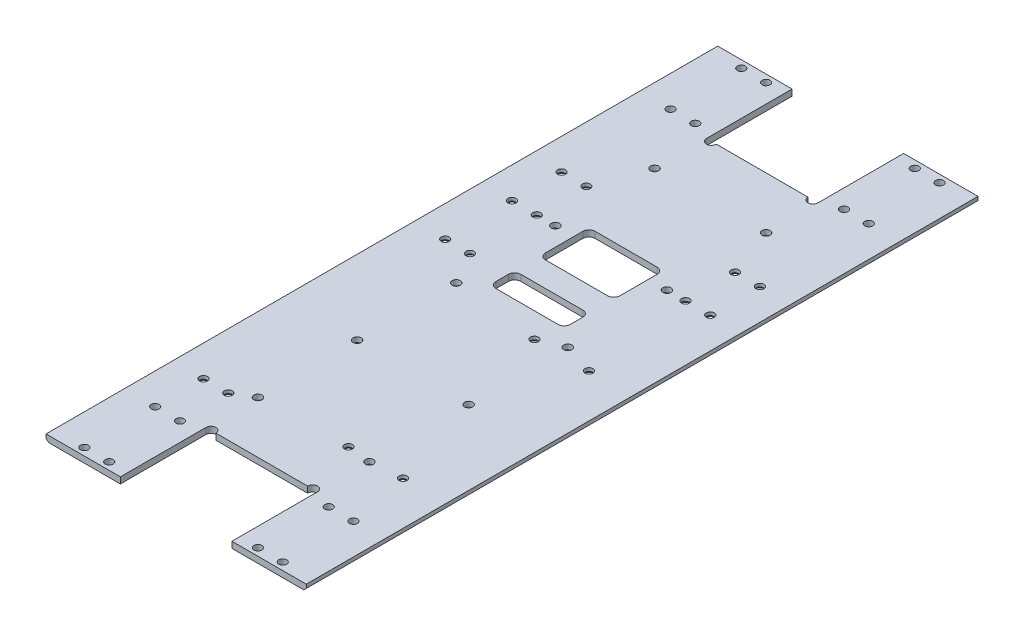
from build123d import *

# Parameters (mm, degrees)
SKETCH_1_W          = 105
SKETCH_1_H          = 271
EXTRUDE_1_DEPTH     = 2.5
SKETCH_2_R          = 1.6
CUT_EXTRUDE_1_DEPTH = 10
CHAMFER_4_SIZE      = 1
SKETCH_3_W          = 45
SKETCH_3_H          = 34.55
CUT_EXTRUDE_2_DEPTH = 10
SKETCH_4_R          = 2
CUT_EXTRUDE_3_DEPTH = 10
SKETCH_5_R          = 1.6
CUT_EXTRUDE_4_DEPTH = 10
SKETCH_6_R          = 1.6
CUT_EXTRUDE_5_DEPTH = 10
SKETCH_7_R          = 1.65
CUT_EXTRUDE_6_DEPTH = 2
CUT_EXTRUDE_7_REACH = 147.337
SKETCH_8_R          = 1.55
CHAMFER_6_SIZE      = 1.2
SKETCH_9_W          = 30
SKETCH_9_H          = 20
SKETCH_9_H_2        = 10
CUT_EXTRUDE_8_DEPTH = 12
FILLET_1_R          = 2.5


with BuildPart() as part:
    # 草图1 → 凸台-拉伸1 (new body)
    with BuildSketch(Plane(origin=(0, 0, 0), x_dir=(1, 0, 0), z_dir=(0, 1, 0))):
        Rectangle(SKETCH_1_W, SKETCH_1_H)
    extrude(amount=EXTRUDE_1_DEPTH)

    # 草图2 → 切除-拉伸1 (cut)
    with BuildSketch(Plane(origin=(0, 2.5, 0), x_dir=(1, 0, 0), z_dir=(0, 1, 0))):
        with Locations((13.000000181, -3.95)):
            Circle(SKETCH_2_R)
        with Locations((35, -3.95)):
            Circle(SKETCH_2_R)
        with Locations((35, -78.95)):
            Circle(SKETCH_2_R)
        with Locations((13.000000181, -78.95)):
            Circle(SKETCH_2_R)
    extrude(amount=-CUT_EXTRUDE_1_DEPTH, mode=Mode.SUBTRACT)

    # 倒角4
    chamfer_4_edges = [part.edges().sort_by_distance(p)[0] for p in [
        (52.5, 0, 0),
        (-52.5, 0, 0),
    ]]
    chamfer(chamfer_4_edges, length=CHAMFER_4_SIZE)

    # 草图3 → 切除-拉伸2 (cut)
    with BuildSketch(Plane.XZ):
        with Locations((0, 118.225)):
            Rectangle(SKETCH_3_W, SKETCH_3_H)
        with Locations((0, -118.225)):
            Rectangle(SKETCH_3_W, SKETCH_3_H)
    extrude(amount=-CUT_EXTRUDE_2_DEPTH, mode=Mode.SUBTRACT)

    # 草图4 → 切除-拉伸3 (cut)
    with BuildSketch(Plane.XZ):
        with Locations((20.5, -100.95)):
            Circle(SKETCH_4_R)
        with Locations((-20.5, -100.95)):
            Circle(SKETCH_4_R)
        with Locations((-20.5, 100.95)):
            Circle(SKETCH_4_R)
        with Locations((20.5, 100.95)):
            Circle(SKETCH_4_R)
    extrude(amount=-CUT_EXTRUDE_3_DEPTH, mode=Mode.SUBTRACT)

    # 草图5 → 切除-拉伸4 (cut)
    with BuildSketch(Plane(origin=(0, 2.5, 0), x_dir=(1, 0, 0), z_dir=(0, 1, 0))):
        with Locations((-40, 103.95)):
            Circle(SKETCH_5_R)
        with Locations((-30, 103.95)):
            Circle(SKETCH_5_R)
        with Locations((-40, 132.5)):
            Circle(SKETCH_5_R)
        with Locations((-30, 132.5)):
            Circle(SKETCH_5_R)
        with Locations((30, 132.5)):
            Circle(SKETCH_5_R)
        with Locations((40, 132.5)):
            Circle(SKETCH_5_R)
        with Locations((30, 103.95)):
            Circle(SKETCH_5_R)
        with Locations((40, 103.95)):
            Circle(SKETCH_5_R)
        with Locations((40, -103.95)):
            Circle(SKETCH_5_R)
        with Locations((30, -103.95)):
            Circle(SKETCH_5_R)
        with Locations((40, -132.5)):
            Circle(SKETCH_5_R)
        with Locations((30, -132.5)):
            Circle(SKETCH_5_R)
        with Locations((-30, -132.5)):
            Circle(SKETCH_5_R)
        with Locations((-40, -132.5)):
            Circle(SKETCH_5_R)
        with Locations((-30, -103.95)):
            Circle(SKETCH_5_R)
        with Locations((-40, -103.95)):
            Circle(SKETCH_5_R)
    extrude(amount=-CUT_EXTRUDE_4_DEPTH, mode=Mode.SUBTRACT)

    # 草图6 → 切除-拉伸5 (cut)
    with BuildSketch(Plane(origin=(0, 2.5, 0), x_dir=(1, 0, 0), z_dir=(0, 1, 0))):
        with Locations((40, 60)):
            Circle(SKETCH_6_R)
        with Locations((30, 60)):
            Circle(SKETCH_6_R)
        with Locations((40, 40)):
            Circle(SKETCH_6_R)
        with Locations((30, 40)):
            Circle(SKETCH_6_R)
        with Locations((-30, 40)):
            Circle(SKETCH_6_R)
        with Locations((-40, 40)):
            Circle(SKETCH_6_R)
        with Locations((-30, 60)):
            Circle(SKETCH_6_R)
        with Locations((-40, 60)):
            Circle(SKETCH_6_R)
        with Locations((-30, -84.45)):
            Circle(SKETCH_6_R)
        with Locations((-40, -84.45)):
            Circle(SKETCH_6_R)
        with Locations((-30, 13.05)):
            Circle(SKETCH_6_R)
        with Locations((-40, 13.05)):
            Circle(SKETCH_6_R)
    extrude(amount=-CUT_EXTRUDE_5_DEPTH, mode=Mode.SUBTRACT)

    # 草图7 → 切除-拉伸6 (cut)
    with BuildSketch(Plane(origin=(0, 2.5, 0), x_dir=(1, 0, 0), z_dir=(0, 1, 0))):
        with Locations((-22.5, 0)):
            Circle(SKETCH_7_R)
        with Locations((-22.5, -40)):
            Circle(SKETCH_7_R)
        with Locations((-22.5, -80)):
            Circle(SKETCH_7_R)
        with Locations((22.5, -80)):
            Circle(SKETCH_7_R)
        with Locations((22.5, -40)):
            Circle(SKETCH_7_R)
        with Locations((22.5, 0)):
            Circle(SKETCH_7_R)
        with Locations((22.5, 40)):
            Circle(SKETCH_7_R)
        with Locations((22.5, 80)):
            Circle(SKETCH_7_R)
        with Locations((-22.5, 80)):
            Circle(SKETCH_7_R)
        with Locations((-22.5, 40)):
            Circle(SKETCH_7_R)
    extrude(amount=-CUT_EXTRUDE_6_DEPTH, mode=Mode.SUBTRACT)

    # 草图8 → 切除-拉伸7 (cut, up to next)
    with BuildSketch(Plane(origin=(0, 2.5, 0), x_dir=(1, 0, 0), z_dir=(0, 1, 0)), mode=Mode.PRIVATE) as cut_extrude_7_sk1:
        with Locations((-22.5, 80)):
            Circle(SKETCH_8_R)
    cut_extrude_7_tool1 = extrude(cut_extrude_7_sk1.sketch, amount=-CUT_EXTRUDE_7_REACH, mode=Mode.PRIVATE) & part.part
    # 草图8 → 切除-拉伸7 (cut, up to next)
    with BuildSketch(Plane(origin=(0, 2.5, 0), x_dir=(1, 0, 0), z_dir=(0, 1, 0)), mode=Mode.PRIVATE) as cut_extrude_7_sk2:
        with Locations((-22.5, 40)):
            Circle(SKETCH_8_R)
    cut_extrude_7_tool2 = extrude(cut_extrude_7_sk2.sketch, amount=-CUT_EXTRUDE_7_REACH, mode=Mode.PRIVATE) & part.part
    # 草图8 → 切除-拉伸7 (cut, up to next)
    with BuildSketch(Plane(origin=(0, 2.5, 0), x_dir=(1, 0, 0), z_dir=(0, 1, 0)), mode=Mode.PRIVATE) as cut_extrude_7_sk3:
        with Locations((-22.5, 0)):
            Circle(SKETCH_8_R)
    cut_extrude_7_tool3 = extrude(cut_extrude_7_sk3.sketch, amount=-CUT_EXTRUDE_7_REACH, mode=Mode.PRIVATE) & part.part
    # 草图8 → 切除-拉伸7 (cut, up to next)
    with BuildSketch(Plane(origin=(0, 2.5, 0), x_dir=(1, 0, 0), z_dir=(0, 1, 0)), mode=Mode.PRIVATE) as cut_extrude_7_sk4:
        with Locations((-22.5, -40)):
            Circle(SKETCH_8_R)
    cut_extrude_7_tool4 = extrude(cut_extrude_7_sk4.sketch, amount=-CUT_EXTRUDE_7_REACH, mode=Mode.PRIVATE) & part.part
    # 草图8 → 切除-拉伸7 (cut, up to next)
    with BuildSketch(Plane(origin=(0, 2.5, 0), x_dir=(1, 0, 0), z_dir=(0, 1, 0)), mode=Mode.PRIVATE) as cut_extrude_7_sk5:
        with Locations((-22.5, -80)):
            Circle(SKETCH_8_R)
    cut_extrude_7_tool5 = extrude(cut_extrude_7_sk5.sketch, amount=-CUT_EXTRUDE_7_REACH, mode=Mode.PRIVATE) & part.part
    # 草图8 → 切除-拉伸7 (cut, up to next)
    with BuildSketch(Plane(origin=(0, 2.5, 0), x_dir=(1, 0, 0), z_dir=(0, 1, 0)), mode=Mode.PRIVATE) as cut_extrude_7_sk6:
        with Locations((22.5, -80)):
            Circle(SKETCH_8_R)
    cut_extrude_7_tool6 = extrude(cut_extrude_7_sk6.sketch, amount=-CUT_EXTRUDE_7_REACH, mode=Mode.PRIVATE) & part.part
    # 草图8 → 切除-拉伸7 (cut, up to next)
    with BuildSketch(Plane(origin=(0, 2.5, 0), x_dir=(1, 0, 0), z_dir=(0, 1, 0)), mode=Mode.PRIVATE) as cut_extrude_7_sk7:
        with Locations((22.5, -40)):
            Circle(SKETCH_8_R)
    cut_extrude_7_tool7 = extrude(cut_extrude_7_sk7.sketch, amount=-CUT_EXTRUDE_7_REACH, mode=Mode.PRIVATE) & part.part
    # 草图8 → 切除-拉伸7 (cut, up to next)
    with BuildSketch(Plane(origin=(0, 2.5, 0), x_dir=(1, 0, 0), z_dir=(0, 1, 0)), mode=Mode.PRIVATE) as cut_extrude_7_sk8:
        with Locations((22.5, 0)):
            Circle(SKETCH_8_R)
    cut_extrude_7_tool8 = extrude(cut_extrude_7_sk8.sketch, amount=-CUT_EXTRUDE_7_REACH, mode=Mode.PRIVATE) & part.part
    # 草图8 → 切除-拉伸7 (cut, up to next)
    with BuildSketch(Plane(origin=(0, 2.5, 0), x_dir=(1, 0, 0), z_dir=(0, 1, 0)), mode=Mode.PRIVATE) as cut_extrude_7_sk9:
        with Locations((22.5, 40)):
            Circle(SKETCH_8_R)
    cut_extrude_7_tool9 = extrude(cut_extrude_7_sk9.sketch, amount=-CUT_EXTRUDE_7_REACH, mode=Mode.PRIVATE) & part.part
    # 草图8 → 切除-拉伸7 (cut, up to next)
    with BuildSketch(Plane(origin=(0, 2.5, 0), x_dir=(1, 0, 0), z_dir=(0, 1, 0)), mode=Mode.PRIVATE) as cut_extrude_7_sk10:
        with Locations((22.5, 80)):
            Circle(SKETCH_8_R)
    cut_extrude_7_tool10 = extrude(cut_extrude_7_sk10.sketch, amount=-CUT_EXTRUDE_7_REACH, mode=Mode.PRIVATE) & part.part
    add(cut_extrude_7_tool1.solids().sort_by_distance((-22.5, 2.5, -80))[0], mode=Mode.SUBTRACT)
    add(cut_extrude_7_tool2.solids().sort_by_distance((-22.5, 2.5, -40))[0], mode=Mode.SUBTRACT)
    add(cut_extrude_7_tool3.solids().sort_by_distance((-22.5, 2.5, 0))[0], mode=Mode.SUBTRACT)
    add(cut_extrude_7_tool4.solids().sort_by_distance((-22.5, 2.5, 40))[0], mode=Mode.SUBTRACT)
    add(cut_extrude_7_tool5.solids().sort_by_distance((-22.5, 2.5, 80))[0], mode=Mode.SUBTRACT)
    add(cut_extrude_7_tool6.solids().sort_by_distance((22.5, 2.5, 80))[0], mode=Mode.SUBTRACT)
    add(cut_extrude_7_tool7.solids().sort_by_distance((22.5, 2.5, 40))[0], mode=Mode.SUBTRACT)
    add(cut_extrude_7_tool8.solids().sort_by_distance((22.5, 2.5, 0))[0], mode=Mode.SUBTRACT)
    add(cut_extrude_7_tool9.solids().sort_by_distance((22.5, 2.5, -40))[0], mode=Mode.SUBTRACT)
    add(cut_extrude_7_tool10.solids().sort_by_distance((22.5, 2.5, -80))[0], mode=Mode.SUBTRACT)

    # 倒角6
    chamfer_6_edges = [part.edges().sort_by_distance(p)[0] for p in [
        (38.4, 0, -60),
        (28.4, 0, -60),
        (38.4, 0, -40),
        (28.4, 0, -40),
        (-31.6, 0, -60),
        (-41.6, 0, -60),
        (-31.6, 0, -40),
        (-41.6, 0, -40),
        (-31.6, 0, 84.45),
        (-41.6, 0, 84.45),
        (-31.6, 0, -13.05),
        (-41.6, 0, -13.05),
        (33.4, 0, 3.95),
        (11.400000181, 0, 3.95),
        (33.4, 0, 78.95),
        (11.400000181, 0, 78.95),
    ]]
    chamfer(chamfer_6_edges, length=CHAMFER_6_SIZE)

    # 草图9 → 切除-拉伸8 (cut)
    with BuildSketch(Plane.XZ):
        with Locations((0, -36.05)):
            Rectangle(SKETCH_9_W, SKETCH_9_H)
        with Locations((0, -11.05)):
            Rectangle(SKETCH_9_W, SKETCH_9_H_2)
    extrude(amount=-CUT_EXTRUDE_8_DEPTH, mode=Mode.SUBTRACT)

    # 圆角1
    fillet_1_edges = [part.edges().sort_by_distance(p)[0] for p in [
        (15, 1.25, -16.05),
        (15, 1.25, -6.05),
        (-15, 1.25, -16.05),
        (-15, 1.25, -6.05),
        (-15, 1.25, -46.05),
        (15, 1.25, -46.05),
        (15, 1.25, -26.05),
        (-15, 1.25, -26.05),
    ]]
    fillet(fillet_1_edges, radius=FILLET_1_R)


solid = part.part
